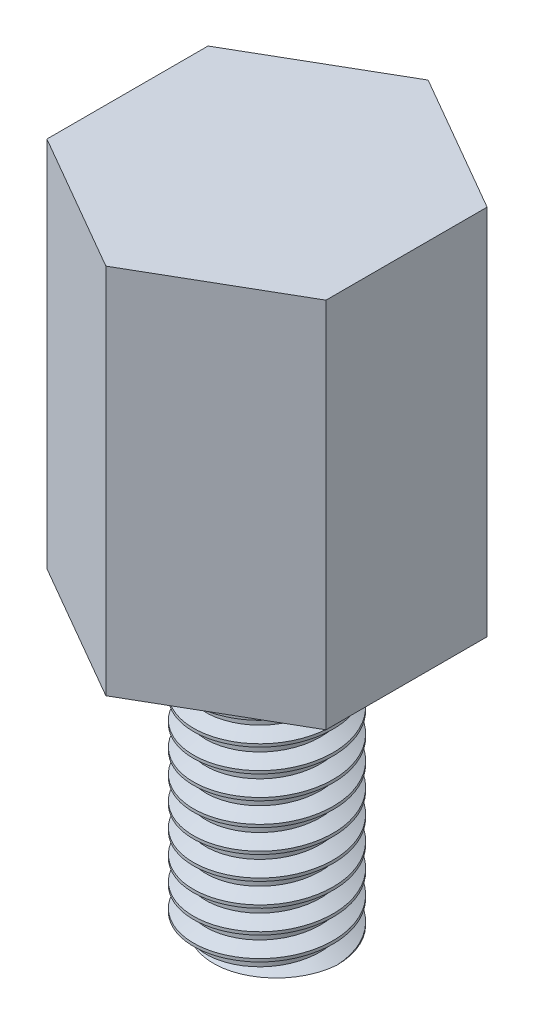
from build123d import *

# Parameters (mm, degrees)
BOSS_EXTRUDE1_DEPTH         = 25
SKETCH2_R                   = 1.5
BOSS_EXTRUDE2_DEPTH         = 6
TAP_DRILL_FOR_M3_TAP1_D     = 2.5
TAP_DRILL_FOR_M3_TAP1_DEPTH = 10
TAP_DRILL_FOR_M3_TAP1_TIP   = 0.751075774
THREAD1_PITCH               = 0.5
THREAD2_PITCH               = 0.5
SKETCH9_R                   = 11.225
SKETCH9_R_2                 = 1.225
CUT_EXTRUDE_THIN1_DEPTH     = 0.5
SKETCH_1_W                  = 10.907082707
SKETCH_1_H                  = 10.130923263
CUT_EXTRUDE_1_DEPTH         = 25


with BuildPart() as part:
    # Sketch1 → Boss-Extrude1 (new body)
    with BuildSketch(Plane(origin=(0, 0, 0), x_dir=(1, 0, 0), z_dir=(0, 1, 0))):
        Polygon((3, 1.732050808), (0, 3.464101615), (-3, 1.732050808), (-3, -1.732050808), (0, -3.464101615), (3, -1.732050808), align=None)
    extrude(amount=BOSS_EXTRUDE1_DEPTH)

    # Sketch2 → Boss-Extrude2 (add)
    with BuildSketch(Plane.XZ):
        with Locations(Location((0, 0, 0), (0, 0, 270))):
            Circle(SKETCH2_R)
    extrude(amount=BOSS_EXTRUDE2_DEPTH)

    # Tap Drill for M3 Tap1
    with Locations(Plane(origin=(0, 25, 0), x_dir=(1, 0, 0), z_dir=(0, 1, 0))):
        with Locations((0, 0)):
            Hole(TAP_DRILL_FOR_M3_TAP1_D / 2, depth=TAP_DRILL_FOR_M3_TAP1_DEPTH)
            with Locations((0, 0, -(TAP_DRILL_FOR_M3_TAP1_DEPTH + TAP_DRILL_FOR_M3_TAP1_TIP / 2))):  # 118° drill point
                Cone(0, TAP_DRILL_FOR_M3_TAP1_D / 2, TAP_DRILL_FOR_M3_TAP1_TIP, mode=Mode.SUBTRACT)

    # Thread1: the profile of Thread Profile1 profile screwed along a right-hand helix of 18 turns, 6 arcs to a turn; built about Z, then put on its axis
    thread1_z = Axis((0, 0, 0), (0, 0, 1))
    thread1_corners = [(1.2497, 0, -0.000173205), (1.520632937, 0, 0.156249999), (1.520632937, 0, 0.218749999), (1.2497, 0, 0.375173204)]
    with BuildLine(mode=Mode.PRIVATE) as thread1_profile:
        Line(thread1_corners[0], thread1_corners[1])
        Line(thread1_corners[1], thread1_corners[2])
        Line(thread1_corners[2], thread1_corners[3])
        Line(thread1_corners[3], thread1_corners[0])
    thread1_cap = Face(thread1_profile.wire())
    thread1_turn_angles = [0, 30, 60, 90, 120, 150, 180, 210, 240, 270, 300, 330, 360]
    thread1_turn_weights = [1, 0.8660254037844387, 1, 0.8660254037844387, 1, 0.8660254037844387, 1, 0.8660254037844387, 1, 0.8660254037844387, 1, 0.8660254037844387, 1]
    thread1_turn_rails = [Edge.make_bspline([Vector(p[0], p[1], 0).rotate(thread1_z, thread1_turn_angles[k]) / thread1_turn_weights[k] + Vector(0, 0, p[2] + THREAD1_PITCH * thread1_turn_angles[k] / 360) for k in range(13)], [0, 0, 0, 1, 1, 2, 2, 3, 3, 4, 4, 5, 5, 6, 6, 6], 2, thread1_turn_weights) for p in thread1_corners]
    thread1_turn_sides = [Face.make_surface_from_curves(thread1_turn_rails[p[0]], thread1_turn_rails[p[1]]) for p in [(0, 1), (1, 2), (2, 3), (3, 0)]]
    thread1 = Plane(origin=(0, 26, 0), x_dir=(-1, 0, 0), z_dir=(0, -1, 0)) * Solid(Shell([*[p.moved(Location((0, 0, THREAD1_PITCH * i))) for i in range(18) for p in thread1_turn_sides], thread1_cap, thread1_cap.rotate(thread1_z, 6480).moved(Location((0, 0, THREAD1_PITCH * 6480 / 360)))]))
    add(thread1, mode=Mode.SUBTRACT)

    # Thread2: the profile of Thread Profile2 profile screwed along a right-hand helix of 13 turns, 6 arcs to a turn; built about Z, then put on its axis
    thread2_z = Axis((0, 0, 0), (0, 0, 1))
    thread2_corners = [(1.5003, 0, -0.000173205), (1.5003, 0, 0.437673204), (1.229367063, 0, 0.281249999), (1.229367063, 0, 0.156249999)]
    with BuildLine(mode=Mode.PRIVATE) as thread2_profile:
        Line(thread2_corners[0], thread2_corners[1])
        Line(thread2_corners[1], thread2_corners[2])
        Line(thread2_corners[2], thread2_corners[3])
        Line(thread2_corners[3], thread2_corners[0])
    thread2_cap = Face(thread2_profile.wire())
    thread2_turn_angles = [0, 30, 60, 90, 120, 150, 180, 210, 240, 270, 300, 330, 360]
    thread2_turn_weights = [1, 0.8660254037844387, 1, 0.8660254037844387, 1, 0.8660254037844387, 1, 0.8660254037844387, 1, 0.8660254037844387, 1, 0.8660254037844387, 1]
    thread2_turn_rails = [Edge.make_bspline([Vector(p[0], p[1], 0).rotate(thread2_z, thread2_turn_angles[k]) / thread2_turn_weights[k] + Vector(0, 0, p[2] + THREAD2_PITCH * thread2_turn_angles[k] / 360) for k in range(13)], [0, 0, 0, 1, 1, 2, 2, 3, 3, 4, 4, 5, 5, 6, 6, 6], 2, thread2_turn_weights) for p in thread2_corners]
    thread2_turn_sides = [Face.make_surface_from_curves(thread2_turn_rails[p[0]], thread2_turn_rails[p[1]]) for p in [(0, 1), (1, 2), (2, 3), (3, 0)]]
    thread2 = Plane(origin=(0, -7, 0), x_dir=(1, 0, 0), z_dir=(0, 1, 0)) * Solid(Shell([*[p.moved(Location((0, 0, THREAD2_PITCH * i))) for i in range(13) for p in thread2_turn_sides], thread2_cap, thread2_cap.rotate(thread2_z, 4680).moved(Location((0, 0, THREAD2_PITCH * 4680 / 360)))]))
    add(thread2, mode=Mode.SUBTRACT)

    # Sketch9 → Cut-Extrude-Thin1 (cut)
    with BuildSketch(Plane(origin=(0, 0, 0), x_dir=(1, 0, 0), z_dir=(0, 1, 0))):
        Circle(SKETCH9_R)
        Circle(SKETCH9_R_2, mode=Mode.SUBTRACT)
    extrude(amount=-CUT_EXTRUDE_THIN1_DEPTH, mode=Mode.SUBTRACT)

    # 草图1 → 切除-拉伸1 (cut)
    with BuildSketch(Plane(origin=(0, 8, 0), x_dir=(-1, 0, 0), z_dir=(0, -1, 0))):
        with Locations((-0.006303019, -0.346176318)):
            Rectangle(SKETCH_1_W, SKETCH_1_H)
    extrude(amount=-CUT_EXTRUDE_1_DEPTH, mode=Mode.SUBTRACT)


solid = part.part
